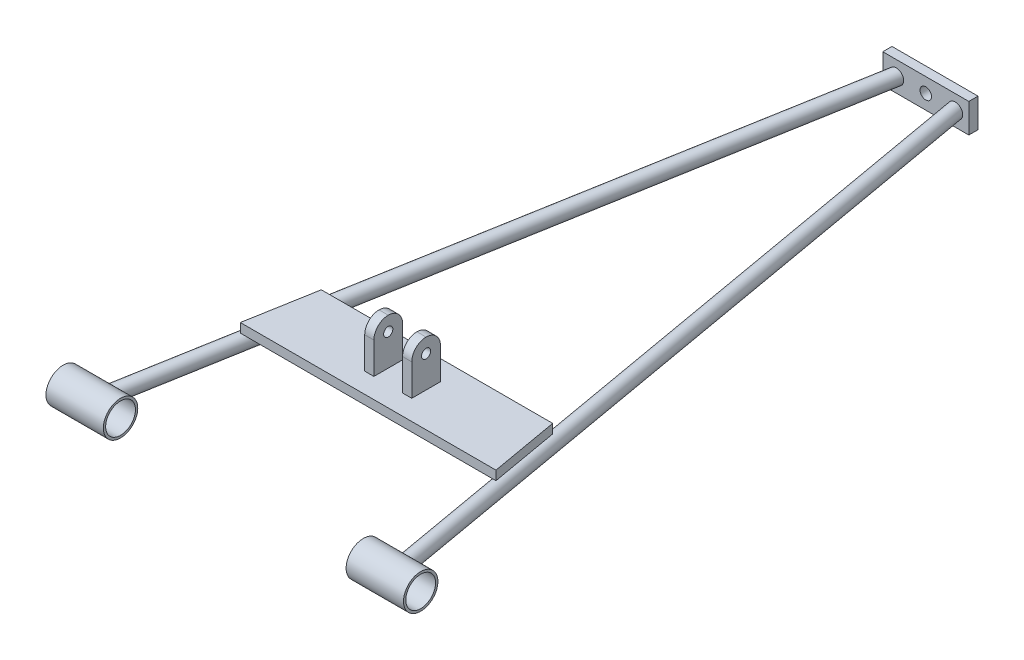
from build123d import *

# Parameters (mm, degrees)
SWEEP2_PROFILE_R        = 6.35
SWEEP3_PROFILE_R        = 6.35
SWEEP_THIN2_PROFILE_R   = 15
SWEEP_THIN2_PROFILE_R_2 = 13
SWEEP_THIN3_PROFILE_R   = 15
SWEEP_THIN3_PROFILE_R_2 = 13
SKETCH161_W             = 75
SKETCH161_H             = 8
BOSS_EXTRUDE1_DEPTH     = 12.7
SKETCH164_W             = 8
SKETCH164_H             = 25.4
CUT_EXTRUDE1_DEPTH      = 635.353542167
SKETCH165_R             = 15
CUT_EXTRUDE2_DEPTH      = 680.802036854
SKETCH166_R             = 5
CUT_EXTRUDE3_DEPTH      = 25.4
BOSS_EXTRUDE2_DEPTH     = 8
SKETCH168_W             = 8
SKETCH168_H             = 25
BOSS_EXTRUDE3_DEPTH     = 40
FILLET1_R               = 12.5
SKETCH170_R             = 4
CUT_EXTRUDE4_DEPTH      = 632.545935426


with BuildPart() as part:
    # Sweep2: sweep along a path in Sketch1
    with BuildLine(Plane(origin=(0, 0, 0), x_dir=(1, 0, 0), z_dir=(0, 1, 0))) as sweep2_path:
        Line((130.796188425, 0), (25, 600))
    # Sweep2 profile (on start of the path) → Sweep2 (sweep)
    with BuildSketch(Plane(origin=(130.796188425, 0, 0), x_dir=(-0.9848077530122079, 0, 0.17364817766693125), z_dir=(-0.17364817766693125, 0, -0.9848077530122079))):
        Circle(SWEEP2_PROFILE_R)
    sweep(path=sweep2_path.line)


with BuildPart() as body_2:
    # Sweep3: sweep along a path in Sketch78
    with BuildLine(Plane(origin=(0, 0, 0), x_dir=(1, 0, 0), z_dir=(0, 1, 0))) as sweep3_path:
        Line((-130.796188425, 0), (-25, 600))
    # Sweep3 profile (on start of the path) → Sweep3 (sweep)
    with BuildSketch(Plane(origin=(-130.796188425, 0, 0), x_dir=(-0.9848077530122079, 0, -0.17364817766693125), z_dir=(0.17364817766693125, 0, -0.9848077530122079))):
        Circle(SWEEP3_PROFILE_R)
    sweep(path=sweep3_path.line)


with BuildPart() as body_3:
    # Sweep-Thin2: sweep along a path in Sketch87
    with BuildLine(Plane(origin=(0, 0, 0), x_dir=(1, 0, 0), z_dir=(0, 1, 0))) as sweep_thin2_path:
        Line((-155.796188425, 0), (-105.796188425, 0))
    # Sweep-Thin2 profile (on start of the path) → Sweep-Thin2 (sweep)
    with BuildSketch(Plane(origin=(-155.796188425, 0, 0), x_dir=(0, 0, 1), z_dir=(1, 0, 0))):
        Circle(SWEEP_THIN2_PROFILE_R)
        Circle(SWEEP_THIN2_PROFILE_R_2, mode=Mode.SUBTRACT)
    sweep(path=sweep_thin2_path.line)


with BuildPart() as body_4:
    # Sweep-Thin3: sweep along a path in Sketch140
    with BuildLine(Plane(origin=(0, 0, 0), x_dir=(1, 0, 0), z_dir=(0, 1, 0))) as sweep_thin3_path:
        Line((105.796188425, 0), (155.796188425, 0))
    # Sweep-Thin3 profile (on start of the path) → Sweep-Thin3 (sweep)
    with BuildSketch(Plane(origin=(105.796188425, 0, 0), x_dir=(0, 0, 1), z_dir=(1, 0, 0))):
        Circle(SWEEP_THIN3_PROFILE_R)
        Circle(SWEEP_THIN3_PROFILE_R_2, mode=Mode.SUBTRACT)
    sweep(path=sweep_thin3_path.line)


with BuildPart() as body_5:
    # Sketch161 → Boss-Extrude1 (new, symmetric)
    with BuildSketch(Plane(origin=(0, 0, 0), x_dir=(1, 0, 0), z_dir=(0, 1, 0))):
        with Locations((0, 600)):
            Rectangle(SKETCH161_W, SKETCH161_H)
    extrude(amount=BOSS_EXTRUDE1_DEPTH, both=True)

    # Sketch166 → Cut-Extrude3 (cut)
    with BuildSketch(Plane(origin=(0, 0, -604), x_dir=(-1, 0, 0), z_dir=(0, 0, -1))):
        Circle(SKETCH166_R)
    extrude(amount=-CUT_EXTRUDE3_DEPTH, mode=Mode.SUBTRACT)


with BuildPart() as cut_extrude1_tool:
    # Sketch164 → Cut-Extrude1 (new, through all)
    with BuildSketch(Plane.ZY.offset(37.5)):
        with Locations((-600, 0)):
            Rectangle(SKETCH164_W, SKETCH164_H)
    extrude(amount=-CUT_EXTRUDE1_DEPTH)


with BuildPart() as body_2_1:
    add(body_2.part)

    # Cut-Extrude1: cut by cut_extrude1_tool
    add(cut_extrude1_tool.part, mode=Mode.SUBTRACT)


with BuildPart() as part_1:
    add(part.part)

    # Cut-Extrude1: cut by cut_extrude1_tool
    add(cut_extrude1_tool.part, mode=Mode.SUBTRACT)


with BuildPart() as cut_extrude2_tool:
    # Sketch165 → Cut-Extrude2 (new, through all)
    with BuildSketch(Plane.ZY.offset(155.796188425)):
        with Locations(Location((0, 0, 0), (0, 0, 180))):
            Circle(SKETCH165_R)
    extrude(amount=-CUT_EXTRUDE2_DEPTH)


with BuildPart() as body_2_2:
    add(body_2_1.part)

    # Cut-Extrude2: cut by cut_extrude2_tool
    add(cut_extrude2_tool.part, mode=Mode.SUBTRACT)


with BuildPart() as part_2:
    add(part_1.part)

    # Cut-Extrude2: cut by cut_extrude2_tool
    add(cut_extrude2_tool.part, mode=Mode.SUBTRACT)


with BuildPart() as body_6:
    # Sketch167 → Boss-Extrude2 (new body)
    with BuildSketch(Plane(origin=(0, 6.35, 0), x_dir=(1, 0, 0), z_dir=(0, 1, 0))):
        Polygon((-111.400220547, 110), (111.400220547, 110), (100.820601705, 170), (-100.820601705, 170), align=None)
    extrude(amount=BOSS_EXTRUDE2_DEPTH)

    # Sketch168 → Boss-Extrude3 (add)
    with BuildSketch(Plane(origin=(0, 14.35, 0), x_dir=(1, 0, 0), z_dir=(0, 1, 0))):
        with Locations((-16.5, 140)):
            Rectangle(SKETCH168_W, SKETCH168_H)
        with Locations((16.5, 140)):
            Rectangle(SKETCH168_W, SKETCH168_H)
    extrude(amount=BOSS_EXTRUDE3_DEPTH)

    # Fillet1
    fillet1_edges = [body_6.edges().sort_by_distance(p)[0] for p in [
        (16.5, 54.35, -152.5),
        (16.5, 54.35, -127.5),
        (-16.5, 54.35, -152.5),
        (-16.5, 54.35, -127.5),
    ]]
    fillet(fillet1_edges, radius=FILLET1_R - 0.0001)  # a hair under: the kernel refuses the full size

    # Sketch170 → Cut-Extrude4 (cut, through all)
    with BuildSketch(Plane(origin=(20.5, 0, 0), x_dir=(0, 0, -1), z_dir=(1, 0, 0))):
        with Locations((140, 41.85)):
            Circle(SKETCH170_R)
    extrude(amount=-CUT_EXTRUDE4_DEPTH, mode=Mode.SUBTRACT)


solid = Compound([body_3.part, body_4.part, body_5.part, body_2_2.part, part_2.part, body_6.part])
